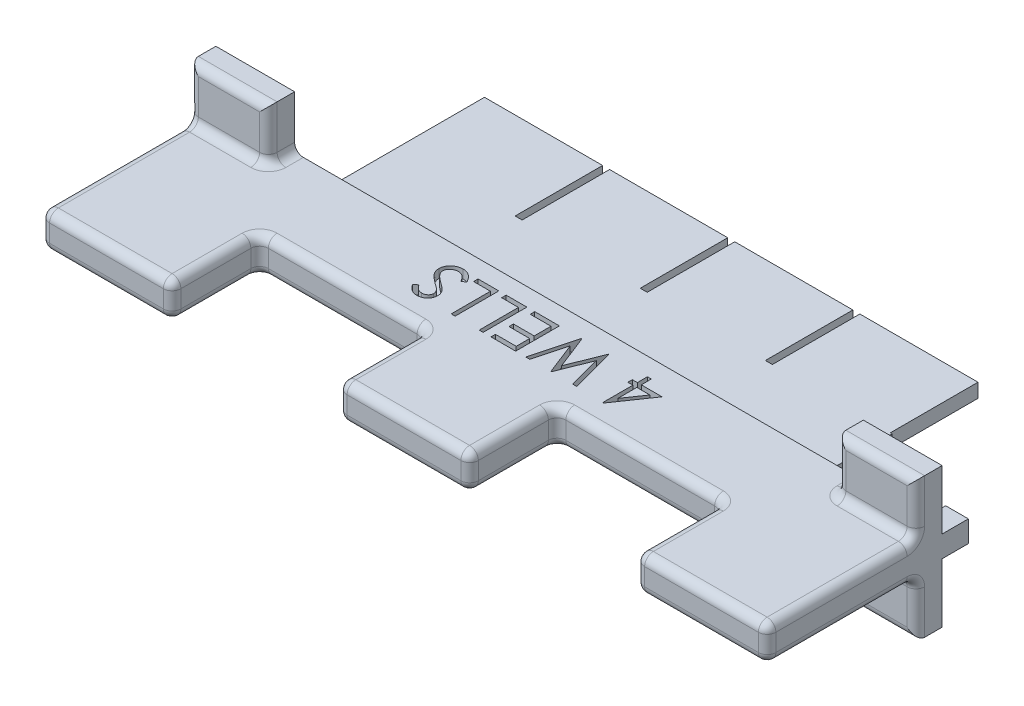
from build123d import *

# Parameters (mm, degrees)
SKETCH1_W           = 83
SKETCH1_H           = 4
BOSS_EXTRUDE1_DEPTH = 10
SKETCH2_W           = 15
SKETCH2_H           = 4
BOSS_EXTRUDE2_DEPTH = 10
SKETCH3_W           = 2.6
SKETCH3_H           = 2.45
BOSS_EXTRUDE3_DEPTH = 3
SKETCH4_W           = 56.6
SKETCH4_H           = 1.6
BOSS_EXTRUDE4_DEPTH = 7.5
SKETCH5_W           = 13.5
SKETCH5_H           = 1.6
BOSS_EXTRUDE5_DEPTH = 10
SKETCH6_W           = 9
SKETCH6_H           = 6
BOSS_EXTRUDE6_DEPTH = 3
FILLET1_R           = 1
CUT_EXTRUDE1_DEPTH  = 1


with BuildPart() as part:
    # Sketch1 → Boss-Extrude1 (new body)
    with BuildSketch(Plane.XY):
        Rectangle(SKETCH1_W, SKETCH1_H)
    extrude(amount=BOSS_EXTRUDE1_DEPTH)

    # Sketch2 → Boss-Extrude2 (add)
    with BuildSketch(Plane.XY.offset(10)):
        with Locations((-34, 0)):
            Rectangle(SKETCH2_W, SKETCH2_H)
        with Locations((34, 0)):
            Rectangle(SKETCH2_W, SKETCH2_H)
        Rectangle(SKETCH2_W, SKETCH2_H)
    extrude(amount=BOSS_EXTRUDE2_DEPTH)

    # Sketch3 → Boss-Extrude3 (add)
    with BuildSketch(Plane(origin=(0, 0, 0), x_dir=(-1, 0, 0), z_dir=(0, 0, -1))):
        with Locations((40.2, 0)):
            Rectangle(SKETCH3_W, SKETCH3_H)
        with Locations((-40.2, 0)):
            Rectangle(SKETCH3_W, SKETCH3_H)
    extrude(amount=BOSS_EXTRUDE3_DEPTH)

    # Sketch4 → Boss-Extrude4 (add)
    with BuildSketch(Plane(origin=(0, 0, 0), x_dir=(-1, 0, 0), z_dir=(0, 0, -1))):
        Rectangle(SKETCH4_W, SKETCH4_H)
    extrude(amount=BOSS_EXTRUDE4_DEPTH)

    # Sketch5 → Boss-Extrude5 (add)
    with BuildSketch(Plane(origin=(0, 0, -7.5), x_dir=(-1, 0, 0), z_dir=(0, 0, -1))):
        with Locations((21.55, 0)):
            Rectangle(SKETCH5_W, SKETCH5_H)
        with Locations((7.25, 0)):
            Rectangle(SKETCH5_W, SKETCH5_H)
        with Locations((-7.05, 0)):
            Rectangle(SKETCH5_W, SKETCH5_H)
        with Locations((-21.35, 0)):
            Rectangle(SKETCH5_W, SKETCH5_H)
    extrude(amount=BOSS_EXTRUDE5_DEPTH)

    # Sketch6 → Boss-Extrude6 (add)
    with BuildSketch(Plane(origin=(0, 0, 0), x_dir=(-1, 0, 0), z_dir=(0, 0, -1))):
        with Locations((37, -5)):
            Rectangle(SKETCH6_W, SKETCH6_H)
        with Locations((37, 5)):
            Rectangle(SKETCH6_W, SKETCH6_H)
        with Locations((-37, -5)):
            Rectangle(SKETCH6_W, SKETCH6_H)
        with Locations((-37, 5)):
            Rectangle(SKETCH6_W, SKETCH6_H)
    extrude(amount=-BOSS_EXTRUDE6_DEPTH)

    # Fillet1
    fillet1_edges = [part.edges().sort_by_distance(p)[0] for p in [
        (-41.5, -2, 11.5),
        (-32.5, -2, 1.5),
        (-37, -2, 3),
        (-32.5, -5, 3),
        (-37, -8, 3),
        (-41.5, -5, 3),
        (-26.5, 0, 20),
        (-34, -2, 20),
        (-41.5, 0, 20),
        (-34, 2, 20),
        (32.5, -2, 1.5),
        (41.5, -2, 11.5),
        (41.5, 2, 11.5),
        (32.5, 2, 1.5),
        (-32.5, 2, 1.5),
        (-41.5, 2, 11.5),
        (37, -8, 3),
        (32.5, -5, 3),
        (37, -2, 3),
        (41.5, -5, 3),
        (34, -2, 20),
        (26.5, 0, 20),
        (34, 2, 20),
        (41.5, 0, 20),
        (37, 2, 3),
        (32.5, 5, 3),
        (37, 8, 3),
        (41.5, 5, 3),
        (0, -2, 20),
        (-7.5, 0, 20),
        (0, 2, 20),
        (7.5, 0, 20),
        (-37, 8, 3),
        (-32.5, 5, 3),
        (-37, 2, 3),
        (-41.5, 5, 3),
        (26.5, 2, 15),
        (26.5, -2, 15),
        (26.5, 0, 10),
        (17, -2, 10),
        (17, 2, 10),
        (7.5, -2, 15),
        (7.5, 2, 15),
        (7.5, 0, 10),
        (-7.5, 2, 15),
        (-7.5, -2, 15),
        (-26.5, -2, 15),
        (-26.5, 2, 15),
        (-26.5, 0, 10),
        (-17, 2, 10),
        (-7.5, 0, 10),
        (-17, -2, 10),
    ]]
    fillet(fillet1_edges, radius=FILLET1_R)

    # Sketch8 → Cut-Extrude1 (cut)
    # profile 1 of 6: a face of its own
    with BuildSketch(Plane(origin=(0, 2, 0), x_dir=(1, 0, 0), z_dir=(0, 1, 0))):
        Polygon((9.962940705, -7.173229261), (9.871794872, -7.173229261), (9.871794872, -3.7116908), (9.294871795, -3.7116908), (9.294871795, -3.198870287), (9.871794872, -3.198870287), (9.871794872, -2.045024133), (10.320512821, -2.045024133), (10.320512821, -3.198870287), (12.692307692, -3.198870287), align=None)
        Polygon((10.320512821, -3.7116908), (10.320512821, -5.883165159), (11.810897436, -3.7116908), align=None, mode=Mode.SUBTRACT)
    # profile 2 of 6: a face of its own
    with BuildSketch(Plane(origin=(0, 2, 0), x_dir=(1, 0, 0), z_dir=(0, 1, 0))):
        Polygon((6.794871795, -7.045024133), (6.331129808, -7.045024133), (5.352564103, -3.378157146), (3.897235577, -7.045024133), (3.83213141, -7.045024133), (2.403846154, -3.40319721), (1.420272436, -7.045024133), (0.961538462, -7.045024133), (2.309695513, -2.045024133), (2.373798077, -2.045024133), (3.878205128, -5.869142723), (5.400641026, -2.045024133), (5.46474359, -2.045024133), align=None)
    # profile 3 of 6: a face of its own
    with BuildSketch(Plane(origin=(0, 2, 0), x_dir=(1, 0, 0), z_dir=(0, 1, 0))):
        Polygon((-0.192307692, -7.045024133), (-3.012820513, -7.045024133), (-3.012820513, -6.53220362), (-0.641025641, -6.53220362), (-0.641025641, -4.993742082), (-3.012820513, -4.993742082), (-3.012820513, -4.480921569), (-0.641025641, -4.480921569), (-0.641025641, -2.557844646), (-3.012820513, -2.557844646), (-3.012820513, -2.045024133), (-0.192307692, -2.045024133), align=None)
    # profile 4 of 6: a face of its own
    with BuildSketch(Plane(origin=(0, 2, 0), x_dir=(1, 0, 0), z_dir=(0, 1, 0))):
        Polygon((-3.91025641, -7.045024133), (-4.358974359, -7.045024133), (-4.358974359, -2.557844646), (-6.282051282, -2.557844646), (-6.282051282, -2.045024133), (-3.91025641, -2.045024133), align=None)
    # profile 5 of 6: a face of its own
    with BuildSketch(Plane(origin=(0, 2, 0), x_dir=(1, 0, 0), z_dir=(0, 1, 0))):
        Polygon((-7.115384615, -7.045024133), (-7.564102564, -7.045024133), (-7.564102564, -2.557844646), (-9.487179487, -2.557844646), (-9.487179487, -2.045024133), (-7.115384615, -2.045024133), align=None)
    # profile 6 of 6: a face of its own
    with BuildSketch(Plane(origin=(0, 2, 0), x_dir=(1, 0, 0), z_dir=(0, 1, 0))):
        with BuildLine():
            Line((-9.807692308, -3.009567402), (-10.23036859, -3.262972851))
            add(Edge.make_bspline(
                [(-10.23036859, -3.262972851), (-10.269680357, -3.197166587), (-10.345000187, -3.071084324), (-10.470644986, -2.900715695), (-10.600834859, -2.755912614), (-10.736533907, -2.63751746), (-10.876913832, -2.544304765), (-11.022891052, -2.478301577), (-11.173973639, -2.437135898), (-11.276793384, -2.432135774), (-11.328125, -2.429639518)],
                knots=[0, 0, 0, 0, 1.272034388, 2.437168799, 3.508375237, 4.49857839, 5.41946034, 6.295179144, 7.148887113, 8, 8, 8, 8], degree=3))
            add(Edge.make_bspline(
                [(-11.328125, -2.429639518), (-11.371954502, -2.430889524), (-11.458846592, -2.433367665), (-11.587016381, -2.456217403), (-11.710872361, -2.493599407), (-11.829181822, -2.544275191), (-11.938815817, -2.606565217), (-12.036480966, -2.680022202), (-12.119001238, -2.764880154), (-12.187223121, -2.858079446), (-12.240628341, -2.957674629), (-12.278627427, -3.061212939), (-12.303037216, -3.168034604), (-12.306132027, -3.240474158), (-12.307692308, -3.276995287)],
                knots=[0, 0, 0, 0, 1.095645842, 2.172120455, 3.244862764, 4.326153987, 5.384857088, 6.392105572, 7.372507978, 8.334705661, 9.272564127, 10.189475455, 11.087205874, 12, 12, 12, 12], degree=3))
            add(Edge.make_bspline(
                [(-12.307692308, -3.276995287), (-12.305631385, -3.318638967), (-12.301457793, -3.40297196), (-12.264675644, -3.52760827), (-12.208510842, -3.65148293), (-12.15572224, -3.72812182), (-12.128405449, -3.767780543)],
                knots=[0, 0, 0, 0, 0.938992559, 1.901562324, 2.914110574, 4, 4, 4, 4], degree=3))
            add(Edge.make_bspline(
                [(-12.128405449, -3.767780543), (-12.106085523, -3.796481036), (-12.059090087, -3.856910995), (-11.977108275, -3.94528344), (-11.883889791, -4.03885355), (-11.777021172, -4.13575368), (-11.658060793, -4.237965999), (-11.525659978, -4.343594856), (-11.381364713, -4.454215663), (-11.27958906, -4.527277526), (-11.226963141, -4.565056185)],
                knots=[0, 0, 0, 0, 0.722283655, 1.520795216, 2.39349503, 3.346893347, 4.386874146, 5.510198126, 6.712579003, 8, 8, 8, 8], degree=3))
            add(Edge.make_bspline(
                [(-11.226963141, -4.565056185), (-11.174364449, -4.602534172), (-11.073799756, -4.674189229), (-10.933053922, -4.780398761), (-10.807364907, -4.878123265), (-10.696092265, -4.966001475), (-10.60211476, -5.047866194), (-10.521996835, -5.119329929), (-10.458694345, -5.184208764), (-10.423468003, -5.226263007), (-10.407652244, -5.245144326)],
                knots=[0, 0, 0, 0, 1.452255772, 2.776602448, 3.96446981, 5.032613149, 5.964194703, 6.766668629, 7.446264616, 8, 8, 8, 8], degree=3))
            add(Edge.make_bspline(
                [(-10.407652244, -5.245144326), (-10.385552312, -5.274575839), (-10.342089832, -5.332456861), (-10.284657031, -5.422900125), (-10.236223793, -5.51530739), (-10.197244092, -5.610013561), (-10.165722685, -5.706306865), (-10.143807221, -5.804910234), (-10.130298992, -5.905154288), (-10.12890363, -5.972599812), (-10.128205128, -6.006362274)],
                knots=[0, 0, 0, 0, 1.068019517, 2.100403715, 3.106014851, 4.09224787, 5.069873182, 6.043214339, 7.020455327, 8, 8, 8, 8], degree=3))
            add(Edge.make_bspline(
                [(-10.128205128, -6.006362274), (-10.130061496, -6.059266485), (-10.133734553, -6.163944115), (-10.165054501, -6.316779541), (-10.213905187, -6.463148887), (-10.284580931, -6.599794501), (-10.371878698, -6.726522677), (-10.475501314, -6.841085368), (-10.597389337, -6.939539184), (-10.733081834, -7.023232798), (-10.879873148, -7.090001634), (-11.034142211, -7.138653592), (-11.195195819, -7.167166609), (-11.304642448, -7.171188521), (-11.360176282, -7.173229261)],
                knots=[0, 0, 0, 0, 1.005367131, 1.989245246, 2.955191616, 3.932180104, 4.904534562, 5.875498653, 6.859376768, 7.874484044, 8.900379497, 9.918679785, 10.943926428, 12, 12, 12, 12], degree=3))
            add(Edge.make_bspline(
                [(-11.360176282, -7.173229261), (-11.419114634, -7.171262547), (-11.535996434, -7.167362316), (-11.707974325, -7.131365167), (-11.874542669, -7.075434995), (-12.008034124, -7.008823238), (-12.112549287, -6.943010929), (-12.192169521, -6.882914417), (-12.273293038, -6.813878112), (-12.355045765, -6.734439505), (-12.438235438, -6.646189546), (-12.522478669, -6.548380569), (-12.608563888, -6.441894176), (-12.663926291, -6.365855922), (-12.692307692, -6.326875095)],
                knots=[0, 0, 0, 0, 1.286534051, 2.551350862, 3.822568981, 5.117864672, 5.799956111, 6.519305446, 7.295594771, 8.126302591, 9.008831062, 9.944975596, 10.946496709, 12, 12, 12, 12], degree=3))
            Line((-12.692307692, -6.326875095), (-12.286658654, -6.019383108))
            add(Edge.make_bspline(
                [(-12.286658654, -6.019383108), (-12.262166251, -6.050940207), (-12.214999609, -6.111711801), (-12.143362298, -6.196789377), (-12.075944738, -6.274609563), (-12.009013791, -6.342024516), (-11.947728709, -6.404083282), (-11.887190861, -6.45627091), (-11.829738911, -6.500244196), (-11.757486688, -6.547233413), (-11.66572616, -6.592695827), (-11.551613284, -6.631782667), (-11.432283383, -6.655803848), (-11.351272947, -6.658856909), (-11.310096154, -6.660408749)],
                knots=[0, 0, 0, 0, 1.181426797, 2.275151783, 3.28963443, 4.225459815, 5.084396437, 5.868484344, 6.587427557, 7.222918358, 8.415355282, 9.605213164, 10.782753814, 12, 12, 12, 12], degree=3))
            add(Edge.make_bspline(
                [(-11.310096154, -6.660408749), (-11.25843179, -6.658706093), (-11.158801931, -6.655422682), (-11.017686229, -6.618619291), (-10.889941304, -6.562662214), (-10.780443797, -6.481972694), (-10.690033403, -6.385775243), (-10.623822408, -6.276068826), (-10.584236018, -6.154902356), (-10.579390713, -6.07042095), (-10.576923077, -6.027395928)],
                knots=[0, 0, 0, 0, 1.144248881, 2.206576175, 3.214949548, 4.222996039, 5.203671638, 6.127710127, 7.046472867, 8, 8, 8, 8], degree=3))
            add(Edge.make_bspline(
                [(-10.576923077, -6.027395928), (-10.577543308, -6.000621284), (-10.578792412, -5.946699014), (-10.593684755, -5.867196304), (-10.615908455, -5.788629526), (-10.647409936, -5.710546018), (-10.690220821, -5.630721251), (-10.748365519, -5.549610209), (-10.821125909, -5.465182894), (-10.876967593, -5.410325386), (-10.906450321, -5.381362274)],
                knots=[0, 0, 0, 0, 0.858500039, 1.728959331, 2.587258638, 3.476905708, 4.426389682, 5.487945037, 6.673710648, 8, 8, 8, 8], degree=3))
            add(Edge.make_bspline(
                [(-10.906450321, -5.381362274), (-10.917395138, -5.371595095), (-10.94339752, -5.348390511), (-10.990934557, -5.310401539), (-11.053709983, -5.263540436), (-11.130084556, -5.205558555), (-11.221466501, -5.138299323), (-11.327865867, -5.062622734), (-11.448096628, -4.976072079), (-11.533413651, -4.915561306), (-11.578525641, -4.8835658)],
                knots=[0, 0, 0, 0, 0.420754252, 0.999615792, 1.744751191, 2.668019286, 3.750313428, 4.999500688, 6.413464383, 8, 8, 8, 8], degree=3))
            add(Edge.make_bspline(
                [(-11.578525641, -4.8835658), (-11.632791193, -4.844078115), (-11.737868914, -4.767615687), (-11.88738026, -4.652736522), (-12.02294107, -4.540381275), (-12.145037317, -4.431274748), (-12.254841634, -4.32622016), (-12.351247129, -4.224035058), (-12.434691218, -4.125389559), (-12.525751578, -3.99977991), (-12.617695548, -3.844082152), (-12.696529945, -3.653237045), (-12.746683039, -3.461844272), (-12.753196542, -3.333371554), (-12.756410256, -3.269984069)],
                knots=[0, 0, 0, 0, 1.163604038, 2.253157948, 3.268574773, 4.215621239, 5.091738613, 5.902582348, 6.650434646, 7.330118262, 8.591011492, 9.77460283, 10.902005569, 12, 12, 12, 12], degree=3))
            add(Edge.make_bspline(
                [(-12.756410256, -3.269984069), (-12.755470009, -3.225158662), (-12.753607773, -3.136378326), (-12.732256542, -3.006001884), (-12.700862764, -2.879431158), (-12.654074114, -2.758241266), (-12.595586942, -2.641081534), (-12.524379279, -2.528157389), (-12.438083699, -2.421324295), (-12.342219663, -2.318507524), (-12.235738973, -2.225519919), (-12.123060663, -2.142697321), (-12.004817169, -2.071782763), (-11.879658172, -2.016070712), (-11.749645381, -1.971505835), (-11.614168507, -1.939562904), (-11.472936436, -1.919891418), (-11.37693436, -1.917854576), (-11.328125, -1.916819005)],
                knots=[0, 0, 0, 0, 0.98378539, 1.948466333, 2.894822735, 3.844243623, 4.795447569, 5.768042124, 6.770299647, 7.807997672, 8.852593179, 9.870666288, 10.876941106, 11.874841786, 12.874492863, 13.892063892, 14.928283473, 16, 16, 16, 16], degree=3))
            add(Edge.make_bspline(
                [(-11.328125, -1.916819005), (-11.290361891, -1.917557632), (-11.215311261, -1.919025584), (-11.104600263, -1.931695771), (-10.995922262, -1.95027676), (-10.890641808, -1.978606014), (-10.787448091, -2.013786535), (-10.687260491, -2.056859669), (-10.589837326, -2.108137258), (-10.495058251, -2.167698619), (-10.40205577, -2.236358883), (-10.311205228, -2.315634394), (-10.222051831, -2.40514569), (-10.134225246, -2.504768208), (-10.04979434, -2.616148638), (-9.966635927, -2.737520615), (-9.885183017, -2.869276248), (-9.834004999, -2.961930236), (-9.807692308, -3.009567402)],
                knots=[0, 0, 0, 0, 0.915366252, 1.81920441, 2.69897508, 3.586533125, 4.459536084, 5.340758185, 6.227946952, 7.126403341, 8.052553006, 9.028121456, 10.047063623, 11.114014537, 12.24582441, 13.433687931, 14.680555077, 16, 16, 16, 16], degree=3))
        make_face()
    extrude(amount=-CUT_EXTRUDE1_DEPTH, mode=Mode.SUBTRACT)


solid = part.part
